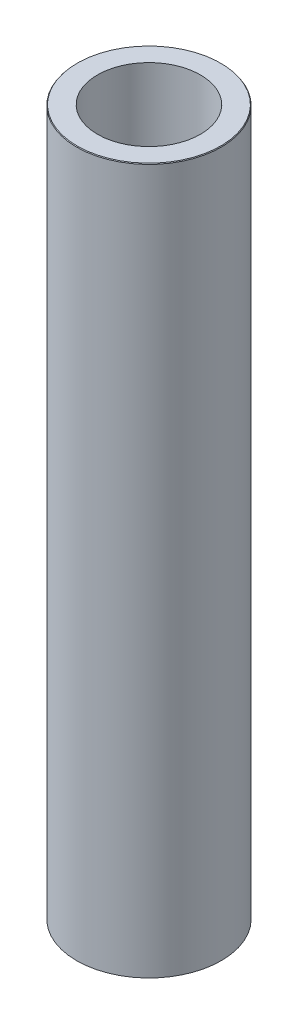
from build123d import *
from OCP.BRepFilletAPI import BRepFilletAPI_MakeChamfer

# Parameters (mm, degrees)
SKETCH1_R           = 40
BOSS_EXTRUDE1_DEPTH = 390.52073446
SKETCH2_R           = 28.484833646
CUT_EXTRUDE1_DEPTH  = 395.59655858
CHAMFER1_SIZE       = 0.407872247
CHAMFER1_SIZE2      = 0.29787387


with BuildPart() as part:
    # Sketch1 → Boss-Extrude1 (new body)
    with BuildSketch(Plane(origin=(0, 0, 0), x_dir=(1, 0, 0), z_dir=(0, 1, 0))):
        Circle(SKETCH1_R)
    extrude(amount=BOSS_EXTRUDE1_DEPTH)

    # Sketch2 → Cut-Extrude1 (cut, through all)
    with BuildSketch(Plane(origin=(0, 0, 0), x_dir=(1, 0, 0), z_dir=(0, 1, 0))):
        Circle(SKETCH2_R)
    extrude(amount=CUT_EXTRUDE1_DEPTH, mode=Mode.SUBTRACT)

    # Chamfer1: one chamfer whose edges measure the first distance from different faces: ONE call of the kernel's chamfer builder (chamfer() names one face for all edges)
    chamfer1_edges_1 = [part.edges().sort_by_distance(p)[0] for p in [
        (-40, 390.52073446, 0),
    ]]
    chamfer1_side_1 = [part.faces().sort_by_distance(p)[0] for p in [
        (-40, 195.26036723, 0),
    ]]
    chamfer1_edges_2 = [part.edges().sort_by_distance(p)[0] for p in [
        (-40, 0, 0),
    ]]
    chamfer1_side_2 = [part.faces().sort_by_distance(p)[0] for p in [
        (-38.86862915, 0, 0),
    ]]
    chamfer1 = BRepFilletAPI_MakeChamfer(part.part.solid().wrapped)
    for e in chamfer1_edges_1:
        chamfer1.Add(CHAMFER1_SIZE, CHAMFER1_SIZE2, e.wrapped, chamfer1_side_1[0].wrapped)  # the first distance lies on this face
    for e in chamfer1_edges_2:
        chamfer1.Add(CHAMFER1_SIZE, CHAMFER1_SIZE2, e.wrapped, chamfer1_side_2[0].wrapped)  # the first distance lies on this face
    add(Compound.cast(chamfer1.Shape()), mode=Mode.REPLACE)


solid = part.part
